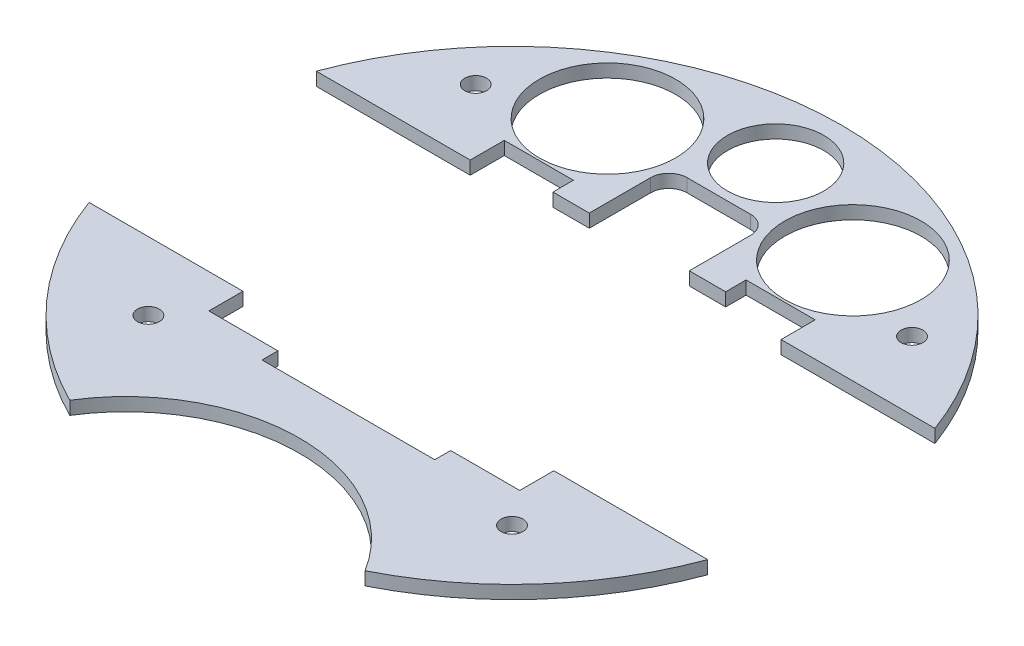
from build123d import *

# Parameters (mm, degrees)
BOSS_EXTRUDE1_DEPTH  = 2.9
SOLENOID_PLACEMENT_W = 38
SOLENOID_PLACEMENT_H = 64
CUT_EXTRUDE1_DEPTH   = 103.571487266
SKETCH3_R            = 12
CUT_EXTRUDE3_DEPTH   = 103.571487266
SKETCH4_R            = 2.4
CUT_EXTRUDE4_DEPTH   = 103.571487266
CUT_EXTRUDE2_DEPTH   = 103.571487266
CUT_EXTRUDE5_DEPTH   = 100.478188564
SKETCH6_R            = 15
CUT_EXTRUDE10_DEPTH  = 100.478188564
SKETCH7_R            = 10.605
CUT_EXTRUDE11_DEPTH  = 100.478188564


with BuildPart() as part:
    # Sketch1 → Boss-Extrude1 (new body)
    with BuildSketch(Plane(origin=(0, 0, 0), x_dir=(1, 0, 0), z_dir=(0, 1, 0))):
        with BuildLine():
            ThreePointArc((32.48910875, -64.812867647), (0, 72.5), (-32.48910875, -64.812867647))
            ThreePointArc((-32.48910875, -64.812867647), (0, -46.75), (32.48910875, -64.812867647))
        make_face()
    extrude(amount=BOSS_EXTRUDE1_DEPTH)

    # solenoid placement → Cut-Extrude1 (cut, through all)
    with BuildSketch(Plane(origin=(0, 2.9, 0), x_dir=(1, 0, 0), z_dir=(0, 1, 0))):
        with Locations((0, -4)):
            Rectangle(SOLENOID_PLACEMENT_W, SOLENOID_PLACEMENT_H)
    extrude(amount=-CUT_EXTRUDE1_DEPTH, mode=Mode.SUBTRACT)

    # Sketch3 → Cut-Extrude3 (cut, through all)
    with BuildSketch(Plane(origin=(0, 2.9, 0), x_dir=(1, 0, 0), z_dir=(0, 1, 0))):
        with Locations((27, 48)):
            Circle(SKETCH3_R)
        with Locations((-27, 48)):
            Circle(SKETCH3_R)
    extrude(amount=-CUT_EXTRUDE3_DEPTH, mode=Mode.SUBTRACT)

    # Sketch4 → Cut-Extrude4 (cut, through all)
    with BuildSketch(Plane(origin=(0, 2.9, 0), x_dir=(1, 0, 0), z_dir=(0, 1, 0))):
        with Locations((40, -40)):
            Circle(SKETCH4_R)
        with Locations((-40, -40)):
            Circle(SKETCH4_R)
        with Locations((48, 40)):
            Circle(SKETCH4_R)
        with Locations((-48, 40)):
            Circle(SKETCH4_R)
    extrude(amount=-CUT_EXTRUDE4_DEPTH, mode=Mode.SUBTRACT)

    # Sketch2 → Cut-Extrude2 (cut, through all)
    with BuildSketch(Plane(origin=(0, 2.9, 0), x_dir=(1, 0, 0), z_dir=(0, 1, 0))):
        with BuildLine():
            Line((-34.2, -32.5), (-22.2, -32.5))
            Line((-22.2, -32.5), (-19, -32.5))
            Line((-19, -32.5), (-19, 32.5))
            Line((-19, 32.5), (-22.2, 32.5))
            Line((-22.2, 32.5), (-34.2, 32.5))
            Line((-34.2, 32.5), (-34.2, 25))
            Line((-34.2, 25), (-68.053287944, 25))
            ThreePointArc((-68.053287944, 25), (-72.5, 0), (-68.053287944, -25))
            Line((-68.053287944, -25), (-34.2, -25))
            Line((-34.2, -25), (-34.2, -32.5))
        make_face()
        with BuildLine():
            Line((19, 32.5), (19, -32.5))
            Line((19, -32.5), (22.2, -32.5))
            Line((22.2, -32.5), (34.2, -32.5))
            Line((34.2, -32.5), (34.2, -25))
            Line((34.2, -25), (68.053287944, -25))
            ThreePointArc((68.053287944, -25), (72.5, 0), (68.053287944, 25))
            Line((68.053287944, 25), (34.2, 25))
            Line((34.2, 25), (34.2, 32.5))
            Line((34.2, 32.5), (22.2, 32.5))
            Line((22.2, 32.5), (19, 32.5))
        make_face()
    extrude(amount=-CUT_EXTRUDE2_DEPTH, mode=Mode.SUBTRACT)


with BuildPart() as cut_extrude2_piece_1:
    # of the separate pieces the step leaves, piece 1, a body of its own (cut_extrude2_pieces)
    add(part.part.solids().sort_by_distance((68.053287944, 0, -25))[0])

    # Sketch5 → Cut-Extrude5 (cut, through all)
    with BuildSketch(Plane(origin=(0, 2.9, 0), x_dir=(1, 0, 0), z_dir=(0, 1, 0))):
        with BuildLine():
            Line((-11, 41.5), (-11, 28))
            Line((-11, 28), (11, 28))
            Line((11, 28), (11, 41.5))
            ThreePointArc((11, 41.5), (9.828427125, 44.328427125), (7, 45.5))
            Line((7, 45.5), (-7, 45.5))
            ThreePointArc((-7, 45.5), (-9.828427125, 44.328427125), (-11, 41.5))
        make_face()
    extrude(amount=-CUT_EXTRUDE5_DEPTH, mode=Mode.SUBTRACT)

    # Sketch6 → Cut-Extrude10 (cut, through all)
    with BuildSketch(Plane(origin=(0, 2.9, 0), x_dir=(-1, 0, 0), z_dir=(0, 1, 0))):
        with Locations((-27, -48)):
            Circle(SKETCH6_R)
        with Locations((27, -48)):
            Circle(SKETCH6_R)
    extrude(amount=-CUT_EXTRUDE10_DEPTH, mode=Mode.SUBTRACT)

    # Sketch7 → Cut-Extrude11 (cut, through all)
    with BuildSketch(Plane(origin=(0, 2.9, 0), x_dir=(1, 0, 0), z_dir=(0, 1, 0))):
        with Locations((0, 58)):
            Circle(SKETCH7_R)
    extrude(amount=-CUT_EXTRUDE11_DEPTH, mode=Mode.SUBTRACT)


with BuildPart() as cut_extrude2_piece_2:
    # of the separate pieces the step leaves, piece 2, a body of its own (cut_extrude2_pieces)
    add(part.part.solids().sort_by_distance((32.48910875, 0, 64.812867647))[0])


solid = Compound([cut_extrude2_piece_1.part, cut_extrude2_piece_2.part])
